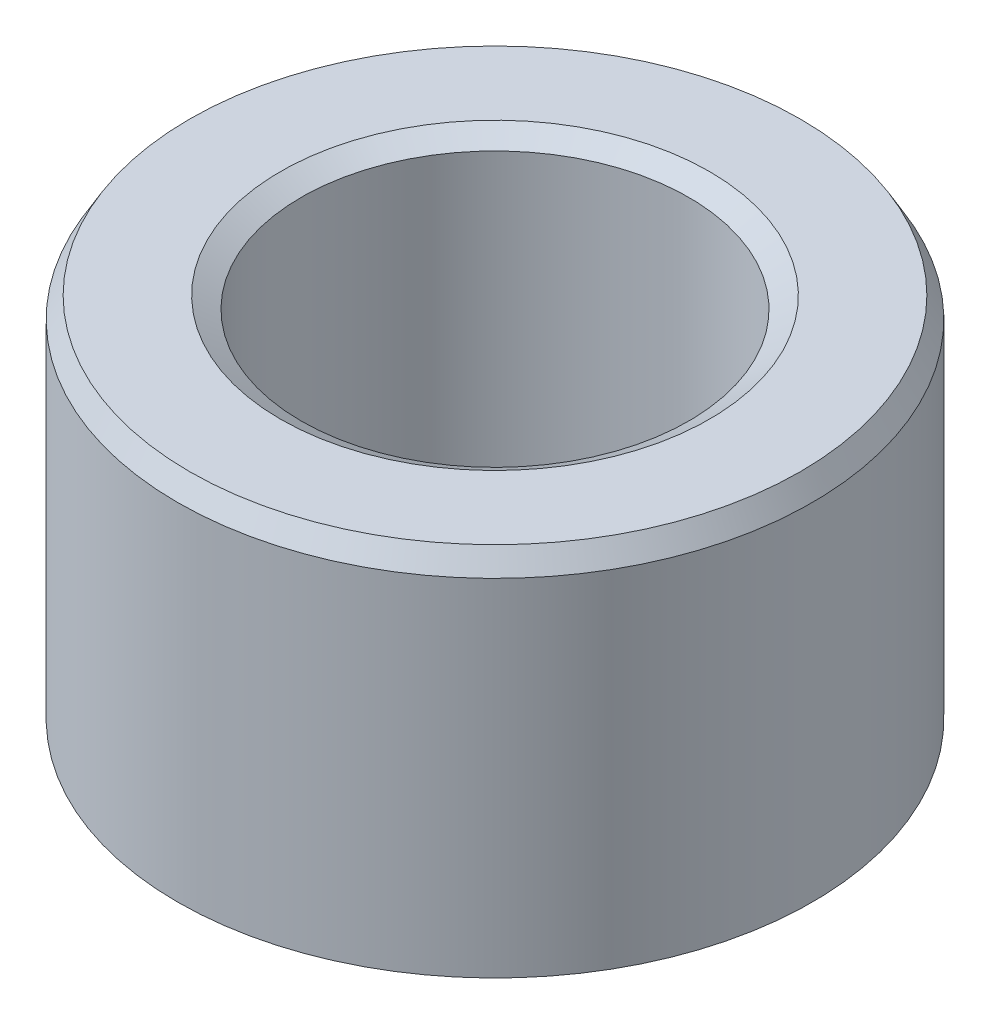
from build123d import *
from OCP.BRepFilletAPI import BRepFilletAPI_MakeChamfer

# Parameters (mm, degrees)
SKETCH1_R           = 40
BOSS_EXTRUDE1_DEPTH = 47.740550985
SKETCH2_R           = 24.424830056
CUT_EXTRUDE1_DEPTH  = 75.021349679
CHAMFER1_SIZE       = 2.612960994
CHAMFER1_SIZE2      = 1.508593733


with BuildPart() as part:
    # Sketch1 → Boss-Extrude1 (new body)
    with BuildSketch(Plane(origin=(0, 0, 0), x_dir=(1, 0, 0), z_dir=(0, 1, 0))):
        Circle(SKETCH1_R)
    extrude(amount=BOSS_EXTRUDE1_DEPTH)

    # Sketch2 → Cut-Extrude1 (cut, through all)
    with BuildSketch(Plane(origin=(0, 0, 0), x_dir=(1, 0, 0), z_dir=(0, 1, 0))):
        Circle(SKETCH2_R)
    extrude(amount=CUT_EXTRUDE1_DEPTH, mode=Mode.SUBTRACT)

    # Chamfer1: one chamfer whose edges measure the first distance from different faces: ONE call of the kernel's chamfer builder (chamfer() names one face for all edges)
    chamfer1_edges_1 = [part.edges().sort_by_distance(p)[0] for p in [
        (-24.424830056, 47.740550985, 0),
    ]]
    chamfer1_side_1 = [part.faces().sort_by_distance(p)[0] for p in [
        (-38.86862915, 47.740550985, 0),
    ]]
    chamfer1_edges_2 = [part.edges().sort_by_distance(p)[0] for p in [
        (-24.424830056, 0, 0),
    ]]
    chamfer1_side_2 = [part.faces().sort_by_distance(p)[0] for p in [
        (-24.424830056, 23.870275492, 0),
    ]]
    chamfer1_edges_3 = [part.edges().sort_by_distance(p)[0] for p in [
        (-40, 0, 0),
    ]]
    chamfer1_side_3 = [part.faces().sort_by_distance(p)[0] for p in [
        (-38.86862915, 0, 0),
    ]]
    chamfer1_edges_4 = [part.edges().sort_by_distance(p)[0] for p in [
        (-40, 47.740550985, 0),
    ]]
    chamfer1_side_4 = [part.faces().sort_by_distance(p)[0] for p in [
        (-40, 23.870275492, 0),
    ]]
    chamfer1 = BRepFilletAPI_MakeChamfer(part.part.solid().wrapped)
    for e in chamfer1_edges_1:
        chamfer1.Add(CHAMFER1_SIZE, CHAMFER1_SIZE2, e.wrapped, chamfer1_side_1[0].wrapped)  # the first distance lies on this face
    for e in chamfer1_edges_2:
        chamfer1.Add(CHAMFER1_SIZE, CHAMFER1_SIZE2, e.wrapped, chamfer1_side_2[0].wrapped)  # the first distance lies on this face
    for e in chamfer1_edges_3:
        chamfer1.Add(CHAMFER1_SIZE, CHAMFER1_SIZE2, e.wrapped, chamfer1_side_3[0].wrapped)  # the first distance lies on this face
    for e in chamfer1_edges_4:
        chamfer1.Add(CHAMFER1_SIZE, CHAMFER1_SIZE2, e.wrapped, chamfer1_side_4[0].wrapped)  # the first distance lies on this face
    add(Compound.cast(chamfer1.Shape()), mode=Mode.REPLACE)


solid = part.part
